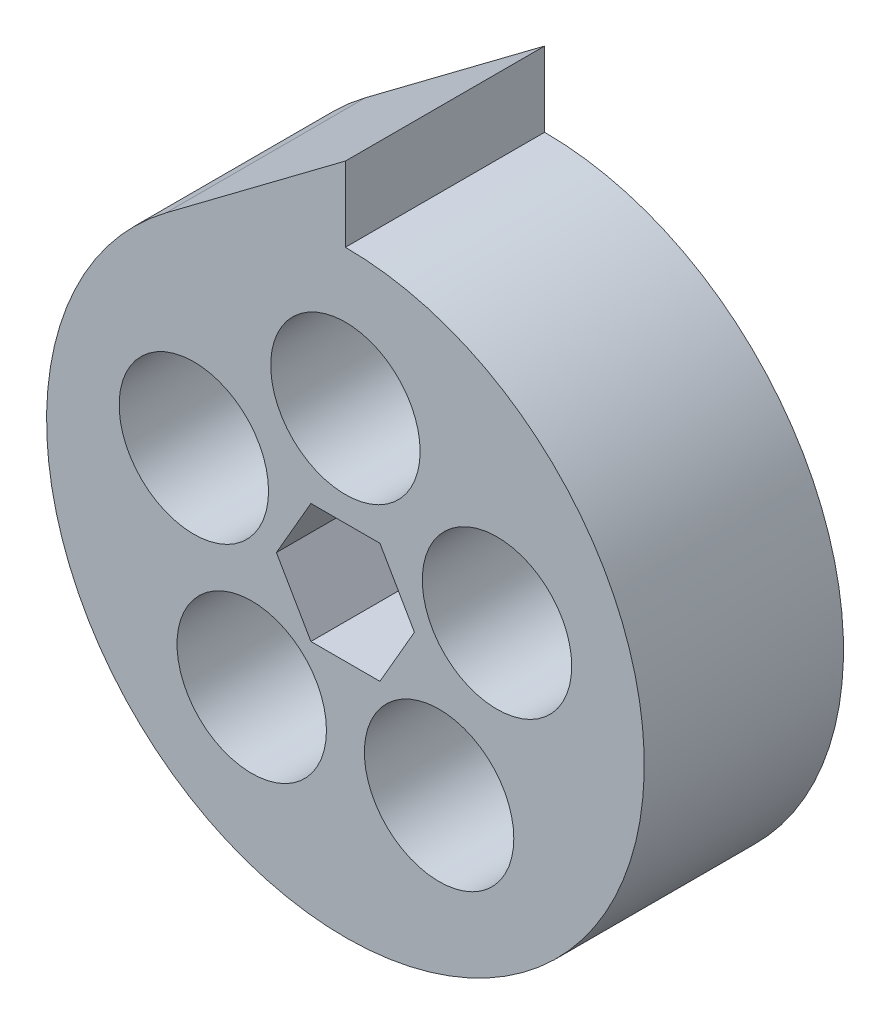
from build123d import *

# Parameters (mm, degrees)
SKETCH3_R           = 7.5
BOSS_EXTRUDE1_DEPTH = 20


with BuildPart() as part:
    # Sketch3 → Boss-Extrude1 (new body)
    with BuildSketch(Plane.XY):
        with BuildLine():
            Line((0, 30), (0, 37.5))
            Line((0, 37.5), (-18, 24))
            ThreePointArc((-18, 24), (9.486832981, -28.460498942), (0, 30))
        make_face()
        with Locations((0, 16)):
            Circle(SKETCH3_R, mode=Mode.SUBTRACT)
        with Locations((15.216904261, 4.94427191)):
            Circle(SKETCH3_R, mode=Mode.SUBTRACT)
        with Locations((9.404564037, -12.94427191)):
            Circle(SKETCH3_R, mode=Mode.SUBTRACT)
        with Locations((-9.404564037, -12.94427191)):
            Circle(SKETCH3_R, mode=Mode.SUBTRACT)
        with Locations((-15.216904261, 4.94427191)):
            Circle(SKETCH3_R, mode=Mode.SUBTRACT)
        Polygon((6.92820323, 0), (3.464101615, 6), (-3.464101615, 6), (-6.92820323, 0), (-3.464101615, -6), (3.464101615, -6), align=None, mode=Mode.SUBTRACT)
    extrude(amount=BOSS_EXTRUDE1_DEPTH)


solid = part.part
